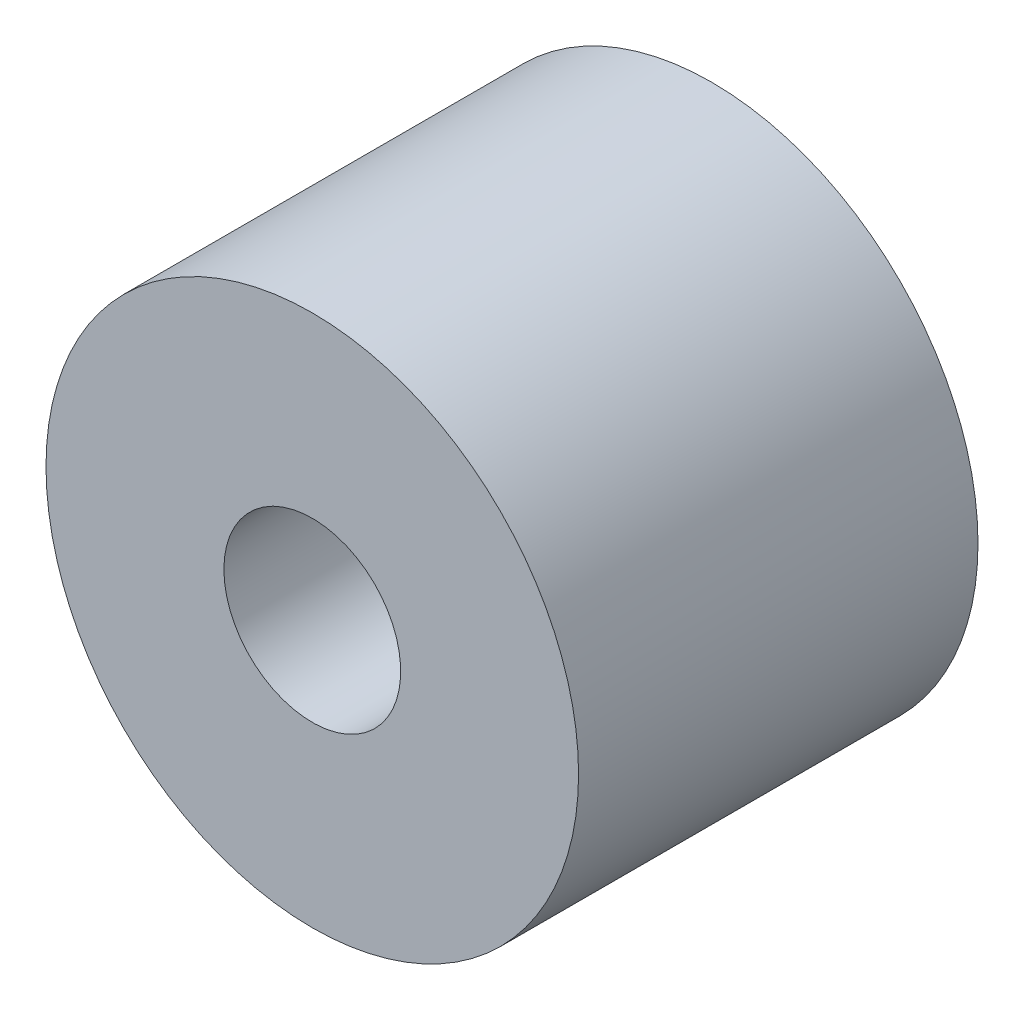
from build123d import *

# Parameters (mm, degrees)
SKETCH1_R      = 6.35
SKETCH1_R_2    = 2.1082
EXTRUDE1_DEPTH = 4.7625


with BuildPart() as part:
    # Sketch1 → Extrude1 (new, symmetric)
    with BuildSketch(Plane.XY):
        Circle(SKETCH1_R)
        Circle(SKETCH1_R_2, mode=Mode.SUBTRACT)
    extrude(amount=EXTRUDE1_DEPTH, both=True)


solid = part.part
